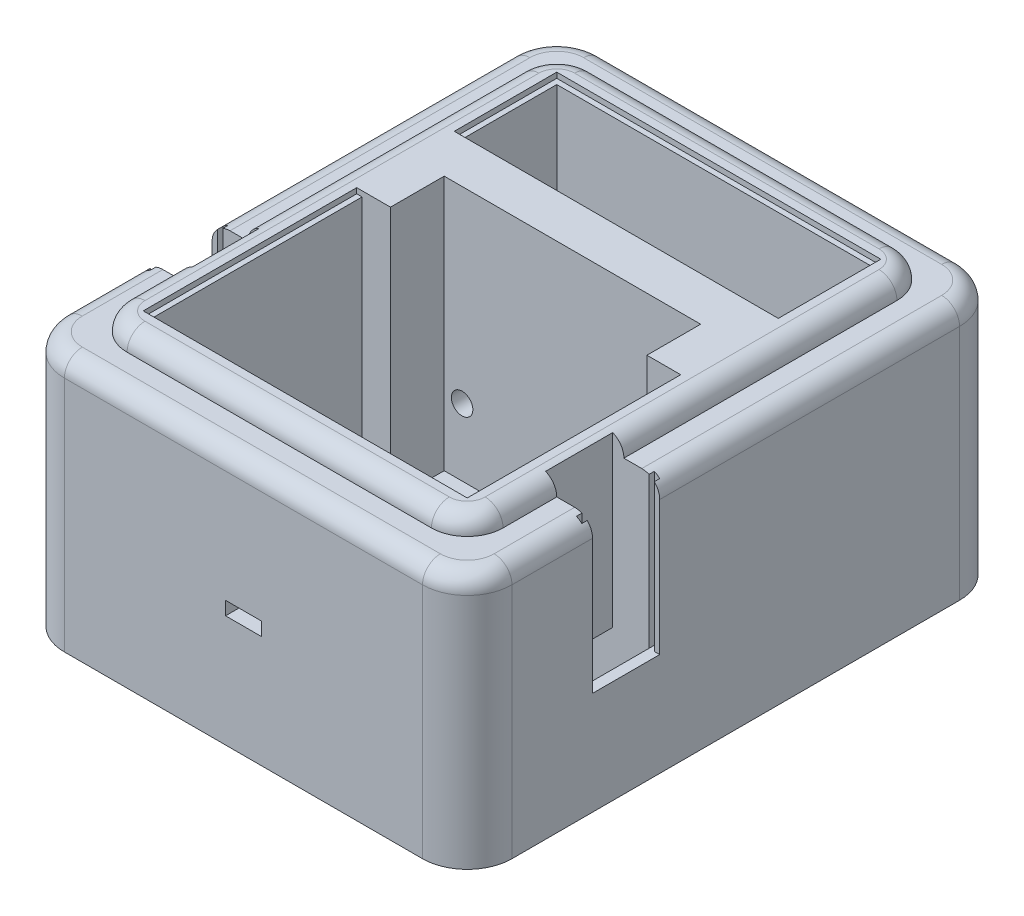
from build123d import *

# Parameters (mm, degrees)
SKICA2_W                  = 100
SKICA2_H                  = 120
P_IDAT_VYSUNUT_M1_DEPTH   = 4
SKICA3_W                  = 15
SKICA3_H                  = 15
SKICA3_W_2                = 70
SKICA3_W_3                = 57.3
SKICA3_H_2                = 3
P_IDAT_VYSUNUT_M2_DEPTH   = 50
SKICA4_W                  = 70
SKICA4_H                  = 20.5
P_IDAT_VYSUNUT_M3_DEPTH   = 23
SKICA8_W                  = 6.35
SKICA8_H                  = 6
ODEBRAT_VYSUNUT_M1_DEPTH  = 23
SKICA9_W                  = 6.35
SKICA9_H                  = 2
P_IDAT_VYSUNUT_M5_DEPTH   = 6
SKICA10_R                 = 2.4
ODEBRAT_VYSUNUT_M2_DEPTH  = 8
SKICA11_W                 = 16.6
SKICA11_H                 = 11.8
ODEBRAT_VYSUNUT_M5_DEPTH  = 10
SKICA14_W                 = 8
SKICA14_H                 = 3
ODEBRAT_VYSUNUT_M6_DEPTH  = 5
SKICA15_W                 = 100
SKICA15_H                 = 120
SKICA15_W_2               = 84
SKICA15_H_2               = 104
ODEBRAT_VYSUNUT_M7_DEPTH  = 4
SKICA20_W                 = 15
SKICA20_H                 = 31
ODEBRAT_VYSUNUT_M8_DEPTH  = 10
SKICA21_W                 = 15
SKICA21_H                 = 31
ODEBRAT_VYSUNUT_M10_DEPTH = 10
SKICA22_R                 = 2.2
ODEBRAT_VYSUNUT_M11_DEPTH = 3
ODEBRAT_START             = -3
SKICA23_R                 = 2.2
ODEBRAT_VYSUNUT_M12_DEPTH = 3
SKICA24_W                 = 1.2
SKICA24_H                 = 1.2
ODEBRAT_VYSUNUT_M14_DEPTH = 27
SKICA26_W                 = 12.6
SKICA26_H                 = 15
ODEBRAT_VYSUNUT_M16_DEPTH = 19
SKICA32_R                 = 2.2
ODEBRAT_VYSUNUT_M19_DEPTH = 158.749801902
SKICA33_W                 = 2
SKICA33_H                 = 6
ODEBRAT_VYSUNUT_M20_DEPTH = 6.35
SKICA35_W                 = 16.6
SKICA35_H                 = 10
ODEBRAT_VYSUNUT_M21_DEPTH = 1.5
SKICA38_W                 = 1
SKICA38_H                 = 23
P_IDAT_VYSUNUT_M9_DEPTH   = 15
SKICA39_W                 = 5.35
SKICA39_H                 = 5
ODEBRAT_VYSUNUT_M23_DEPTH = 23
SKICA40_W                 = 15
SKICA40_H                 = 31
ODEBRAT_VYSUNUT_M24_DEPTH = 0.5
SKICA41_W                 = 15
SKICA41_H                 = 31
ODEBRAT_VYSUNUT_M25_DEPTH = 0.5
SKICA43_W                 = 70
SKICA43_H                 = 20.5
P_IDAT_VYSUNUT_M10_DEPTH  = 7
P_IDAT_VYSUNUT_M11_DEPTH  = 7
SKICA45_W                 = 70
SKICA45_H                 = 1.2
SKICA45_H_2               = 20.5
SKICA45_W_2               = 1.2
SKICA45_H_3               = 46.5
ODEBRAT_VYSUNUT_M26_DEPTH = 1.2
ZAOBLIT1_R                = 10
ZAOBLIT2_R                = 8
ZAOBLIT3_R                = 4


with BuildPart() as part:
    # Skica2 → Přidat vysunutím1 (new body)
    with BuildSketch(Plane(origin=(0, 0, 0), x_dir=(1, 0, 0), z_dir=(0, 1, 0))):
        with Locations((50, 60)):
            Rectangle(SKICA2_W, SKICA2_H)
    extrude(amount=P_IDAT_VYSUNUT_M1_DEPTH)

    # Skica3 → Přidat vysunutím2 (add)
    with BuildSketch(Plane(origin=(0, 4, 0), x_dir=(1, 0, 0), z_dir=(0, 1, 0))):
        with Locations((7.5, 112.5)):
            Rectangle(SKICA3_W, SKICA3_H)
        with Locations((50, 112.5)):
            Rectangle(SKICA3_W_2, SKICA3_H)
        Polygon((15, 105), (0, 105), (0, 15), (15, 15), (15, 61.5), (15, 76.5), (15, 84.5), align=None)
        with Locations((92.5, 112.5)):
            Rectangle(SKICA3_W, SKICA3_H)
        Polygon((100, 105), (85, 105), (85, 84.5), (85, 76.5), (85, 61.5), (85, 15), (100, 15), align=None)
        Polygon((85, 84.5), (15, 84.5), (15, 76.5), (21.35, 76.5), (78.65, 76.5), (85, 76.5), align=None)
        with Locations((7.5, 7.5)):
            Rectangle(SKICA3_W, SKICA3_H)
        with Locations((50, 7.5)):
            Rectangle(SKICA3_W_2, SKICA3_H)
        with Locations((92.5, 7.5)):
            Rectangle(SKICA3_W, SKICA3_H)
        Polygon((21.35, 76.5), (15, 76.5), (15, 61.5), (21.35, 61.5), (21.35, 73.5), align=None)
        with Locations((50, 75)):
            Rectangle(SKICA3_W_3, SKICA3_H_2)
        Polygon((85, 61.5), (85, 76.5), (78.65, 76.5), (78.65, 73.5), (78.65, 61.5), align=None)
    extrude(amount=P_IDAT_VYSUNUT_M2_DEPTH)

    # Skica4 → Přidat vysunutím3 (add)
    with BuildSketch(Plane(origin=(0, 4, 0), x_dir=(1, 0, 0), z_dir=(0, 1, 0))):
        with Locations((50, 94.75)):
            Rectangle(SKICA4_W, SKICA4_H)
    extrude(amount=P_IDAT_VYSUNUT_M3_DEPTH)

    # Skica8 → Odebrat vysunutím1 (cut)
    with BuildSketch(Plane.XY.offset(-61.5)):
        with Locations((81.825, 30)):
            Rectangle(SKICA8_W, SKICA8_H)
    extrude(amount=-ODEBRAT_VYSUNUT_M1_DEPTH, mode=Mode.SUBTRACT)

    # Skica9 → Přidat vysunutím5 (add)
    with BuildSketch(Plane(origin=(0, 27, 0), x_dir=(1, 0, 0), z_dir=(0, 1, 0))):
        with Locations((81.825, 62.5)):
            Rectangle(SKICA9_W, SKICA9_H)
    extrude(amount=P_IDAT_VYSUNUT_M5_DEPTH)

    # Skica10 → Odebrat vysunutím2 (cut)
    with BuildSketch(Plane.XY.offset(-73.5)):
        with Locations((25.35, 19)):
            Circle(SKICA10_R)
        with Locations((74.65, 19)):
            Circle(SKICA10_R)
    extrude(amount=-ODEBRAT_VYSUNUT_M2_DEPTH, mode=Mode.SUBTRACT)

    # Skica11 → Odebrat vysunutím5 (cut)
    with BuildSketch(Plane(origin=(0, 0, -15), x_dir=(-1, 0, 0), z_dir=(0, 0, -1))):
        with Locations((-50, 24.9)):
            Rectangle(SKICA11_W, SKICA11_H)
    extrude(amount=-ODEBRAT_VYSUNUT_M5_DEPTH, mode=Mode.SUBTRACT)

    # Skica14 → Odebrat vysunutím6 (cut)
    with BuildSketch(Plane.XY):
        with Locations((50, 26.5)):
            Rectangle(SKICA14_W, SKICA14_H)
    extrude(amount=-ODEBRAT_VYSUNUT_M6_DEPTH, mode=Mode.SUBTRACT)

    # Skica15 → Odebrat vysunutím7 (cut)
    with BuildSketch(Plane(origin=(0, 54, 0), x_dir=(1, 0, 0), z_dir=(0, 1, 0))):
        with Locations((50, 60)):
            Rectangle(SKICA15_W, SKICA15_H)
        with Locations((50, 60)):
            Rectangle(SKICA15_W_2, SKICA15_H_2, mode=Mode.SUBTRACT)
    extrude(amount=-ODEBRAT_VYSUNUT_M7_DEPTH, mode=Mode.SUBTRACT)

    # Skica20 → Odebrat vysunutím8 (cut)
    with BuildSketch(Plane.ZY):
        with Locations((-35.5, 38.5)):
            Rectangle(SKICA20_W, SKICA20_H)
    extrude(amount=-ODEBRAT_VYSUNUT_M8_DEPTH, mode=Mode.SUBTRACT)

    # Skica21 → Odebrat vysunutím10 (cut)
    with BuildSketch(Plane(origin=(100, 0, 0), x_dir=(0, 0, -1), z_dir=(1, 0, 0))):
        with Locations((35.5, 38.5)):
            Rectangle(SKICA21_W, SKICA21_H)
    extrude(amount=-ODEBRAT_VYSUNUT_M10_DEPTH, mode=Mode.SUBTRACT)

    # Skica22 → Odebrat vysunutím11 (cut)
    with BuildSketch(Plane.ZY.offset(-10)):
        with Locations((-35.5, 31.3)):
            Circle(SKICA22_R)
    extrude(amount=-ODEBRAT_VYSUNUT_M11_DEPTH, mode=Mode.SUBTRACT)

    # Skica23 → Odebrat vysunutím12 (cut)
    with BuildSketch(Plane(origin=(90, 0, 0), x_dir=(0, 0, -1), z_dir=(1, 0, 0)).offset(ODEBRAT_START)):
        with Locations(Location((35.5, 31.3, 0), (0, 0, 180))):
            Circle(SKICA23_R)
    extrude(amount=ODEBRAT_VYSUNUT_M12_DEPTH, mode=Mode.SUBTRACT)

    # Skica24 → Odebrat vysunutím14 (cut)
    with BuildSketch(Plane(origin=(0, 50, 0), x_dir=(1, 0, 0), z_dir=(0, 1, 0))):
        with Locations((1.8, 27.4)):
            Rectangle(SKICA24_W, SKICA24_H)
        with Locations((1.8, 43.6)):
            Rectangle(SKICA24_W, SKICA24_H)
        with Locations((98.2, 27.4)):
            Rectangle(SKICA24_W, SKICA24_H)
        with Locations((98.2, 43.6)):
            Rectangle(SKICA24_W, SKICA24_H)
    extrude(amount=-ODEBRAT_VYSUNUT_M14_DEPTH, mode=Mode.SUBTRACT)

    # Skica26 → Odebrat vysunutím16 (cut)
    with BuildSketch(Plane(origin=(0, 23, 0), x_dir=(1, 0, 0), z_dir=(0, 1, 0))):
        with Locations((8.7, 35.5)):
            Rectangle(SKICA26_W, SKICA26_H)
        with Locations((91.3, 35.5)):
            Rectangle(SKICA26_W, SKICA26_H)
    extrude(amount=-ODEBRAT_VYSUNUT_M16_DEPTH, mode=Mode.SUBTRACT)

    # Skica32 → Odebrat vysunutím19 (cut, through all)
    with BuildSketch(Plane.ZY.offset(-13)):
        with Locations((-35.5, 31.3)):
            Circle(SKICA32_R)
    extrude(amount=-ODEBRAT_VYSUNUT_M19_DEPTH, mode=Mode.SUBTRACT)

    # Skica33 → Odebrat vysunutím20 (cut)
    with BuildSketch(Plane.ZY.offset(-78.65)):
        with Locations((-62.5, 30)):
            Rectangle(SKICA33_W, SKICA33_H)
    extrude(amount=-ODEBRAT_VYSUNUT_M20_DEPTH, mode=Mode.SUBTRACT)

    # Skica35 → Odebrat vysunutím21 (cut)
    with BuildSketch(Plane(origin=(0, 19, 0), x_dir=(1, 0, 0), z_dir=(0, 1, 0))):
        with Locations((50, 10)):
            Rectangle(SKICA35_W, SKICA35_H)
    extrude(amount=-ODEBRAT_VYSUNUT_M21_DEPTH, mode=Mode.SUBTRACT)

    # Skica38 → Přidat vysunutím9 (add)
    with BuildSketch(Plane(origin=(0, 27, 0), x_dir=(1, 0, 0), z_dir=(0, 1, 0))):
        with Locations((79.15, 73)):
            Rectangle(SKICA38_W, SKICA38_H)
    extrude(amount=P_IDAT_VYSUNUT_M9_DEPTH)

    # Skica39 → Odebrat vysunutím23 (cut)
    with BuildSketch(Plane.XY.offset(-61.5)):
        with Locations((82.325, 35.5)):
            Rectangle(SKICA39_W, SKICA39_H)
    extrude(amount=-ODEBRAT_VYSUNUT_M23_DEPTH, mode=Mode.SUBTRACT)

    # Skica40 → Odebrat vysunutím24 (cut)
    with BuildSketch(Plane.ZY.offset(-10)):
        with Locations((-35.5, 38.5)):
            Rectangle(SKICA40_W, SKICA40_H)
    extrude(amount=-ODEBRAT_VYSUNUT_M24_DEPTH, mode=Mode.SUBTRACT)

    # Skica41 → Odebrat vysunutím25 (cut)
    with BuildSketch(Plane(origin=(90, 0, 0), x_dir=(0, 0, -1), z_dir=(1, 0, 0))):
        with Locations((35.5, 38.5)):
            Rectangle(SKICA41_W, SKICA41_H)
    extrude(amount=-ODEBRAT_VYSUNUT_M25_DEPTH, mode=Mode.SUBTRACT)

    # Skica43 → Přidat vysunutím10 (add)
    with BuildSketch(Plane(origin=(0, 54, 0), x_dir=(1, 0, 0), z_dir=(0, 1, 0))):
        Polygon((92, 8), (92, 28), (89.5, 28), (89.5, 43), (92, 43), (92, 112), (8, 112), (8, 43), (10.5, 43), (10.5, 28), (8, 28), (8, 8), align=None)
        with Locations((50, 94.75)):
            Rectangle(SKICA43_W, SKICA43_H, mode=Mode.SUBTRACT)
        Polygon((78.65, 73.5), (78.65, 61.5), (85, 61.5), (85, 15), (15, 15), (15, 61.5), (21.35, 61.5), (21.35, 73.5), align=None, mode=Mode.SUBTRACT)
    extrude(amount=P_IDAT_VYSUNUT_M10_DEPTH)

    # Skica44 → Přidat vysunutím11 (add)
    with BuildSketch(Plane(origin=(0, 50, 0), x_dir=(1, 0, 0), z_dir=(0, 1, 0))):
        Polygon((0, 120), (0, 43), (1.2, 43), (1.2, 44.2), (2.4, 44.2), (2.4, 43), (8, 43), (8, 112), (92, 112), (92, 43), (97.6, 43), (97.6, 44.2), (98.8, 44.2), (98.8, 43), (100, 43), (100, 120), align=None)
        Polygon((1.2, 28), (0, 28), (0, 0), (100, 0), (100, 28), (98.8, 28), (98.8, 26.8), (97.6, 26.8), (97.6, 28), (92, 28), (92, 8), (8, 8), (8, 28), (2.4, 28), (2.4, 26.8), (1.2, 26.8), align=None)
    extrude(amount=P_IDAT_VYSUNUT_M11_DEPTH)

    # Skica45 → Odebrat vysunutím26 (cut)
    with BuildSketch(Plane(origin=(0, 61, 0), x_dir=(1, 0, 0), z_dir=(0, 1, 0))):
        with Locations((50, 105.6)):
            Rectangle(SKICA45_W, SKICA45_H)
        Polygon((15, 84.5), (15, 105), (15, 106.2), (13.8, 106.2), (13.8, 84.5), align=None)
        with Locations((50, 94.75)):
            Rectangle(SKICA45_W, SKICA45_H_2)
        Polygon((85, 106.2), (85, 105), (85, 84.5), (85, 83.3), (86.2, 83.3), (86.2, 106.2), align=None)
        Polygon((85, 84.5), (15, 84.5), (13.8, 84.5), (13.8, 83.3), (85, 83.3), align=None)
        Polygon((85, 15), (15, 15), (13.8, 15), (13.8, 13.8), (85, 13.8), align=None)
        with Locations((14.4, 38.25)):
            Rectangle(SKICA45_W_2, SKICA45_H_3)
        Polygon((85, 61.5), (85, 15), (85, 13.8), (86.2, 13.8), (86.2, 61.5), align=None)
    extrude(amount=-ODEBRAT_VYSUNUT_M26_DEPTH, mode=Mode.SUBTRACT)

    # Zaoblit1
    zaoblit1_edges = [part.edges().sort_by_distance(p)[0] for p in [
        (0, 28.5, -120),
        (100, 28.5, -120),
        (100, 28.5, 0),
        (0, 28.5, 0),
    ]]
    fillet(zaoblit1_edges, radius=ZAOBLIT1_R)

    # Zaoblit2
    zaoblit2_edges = [part.edges().sort_by_distance(p)[0] for p in [
        (92, 59, -8),
        (8, 59, -8),
        (8, 59, -112),
        (92, 59, -112),
    ]]
    fillet(zaoblit2_edges, radius=ZAOBLIT2_R)

    # Zaoblit3
    # the kernel refuses this fillet: 4 mm, written as the material it takes off along each edge
    with BuildSketch(Plane(origin=(8, 61, -104), x_dir=(1, 0, 0), z_dir=(0, 0, 1)), Plane(origin=(92, 61, -33), x_dir=(-1, 0, 0), z_dir=(0, 0, -1))) as zaoblit3_piece_1:
        with BuildLine():
            CenterArc((ZAOBLIT3_R, -ZAOBLIT3_R), ZAOBLIT3_R, 90, 90)
            Line((0, -ZAOBLIT3_R), (0, 0))
            Line((0, 0), (ZAOBLIT3_R, 0))
        make_face()
    extrude(amount=71, mode=Mode.SUBTRACT)
    with BuildSketch(Plane(origin=(100, 57, -10), x_dir=(-1, 0, 0), z_dir=(0, 0, -1)), Plane(origin=(0, 57, -38), x_dir=(1, 0, 0), z_dir=(0, 0, 1))) as zaoblit3_piece_2:
        with BuildLine():
            CenterArc((ZAOBLIT3_R, -ZAOBLIT3_R), ZAOBLIT3_R, 90, 90)
            Line((0, -ZAOBLIT3_R), (0, 0))
            Line((0, 0), (ZAOBLIT3_R, 0))
        make_face()
    extrude(amount=28, mode=Mode.SUBTRACT)
    with BuildSketch(Plane(origin=(100, 57, -33), x_dir=(0, -1, 0), z_dir=(0, 0, -1)), Plane(origin=(0, 57, -110), x_dir=(0, -1, 0), z_dir=(0, 0, 1))) as zaoblit3_piece_3:
        with BuildLine():
            CenterArc((ZAOBLIT3_R, ZAOBLIT3_R), ZAOBLIT3_R, 180, 90)
            Line((0, ZAOBLIT3_R), (0, 0))
            Line((0, 0), (ZAOBLIT3_R, 0))
        make_face()
    extrude(amount=77, mode=Mode.SUBTRACT)
    with BuildSketch(Plane(origin=(10, 57, 0), x_dir=(0, 0, -1), z_dir=(1, 0, 0)), Plane(origin=(90, 57, -120), x_dir=(0, 0, 1), z_dir=(-1, 0, 0))) as zaoblit3_piece_4:
        with BuildLine():
            CenterArc((ZAOBLIT3_R, -ZAOBLIT3_R), ZAOBLIT3_R, 90, 90)
            Line((0, -ZAOBLIT3_R), (0, 0))
            Line((0, 0), (ZAOBLIT3_R, 0))
        make_face()
    extrude(amount=80, mode=Mode.SUBTRACT)
    with BuildSketch(Plane(origin=(10, 57, -10), x_dir=(0, 0, 1), z_dir=(1, 0, 0))) as zaoblit3_piece_5:
        with BuildLine():
            CenterArc((10 - ZAOBLIT3_R, ZAOBLIT3_R), ZAOBLIT3_R, 270, 90)
            Line((10, ZAOBLIT3_R), (10, 0))
            Line((10, 0), (10 - ZAOBLIT3_R, 0))
        make_face()
    revolve(axis=Axis((10, 57, -10), (0, -1, 0)), revolution_arc=90, mode=Mode.SUBTRACT)
    with BuildSketch(Plane(origin=(90, 57, -10), x_dir=(0, 0, 1), z_dir=(-1, 0, 0))) as zaoblit3_piece_6:
        with BuildLine():
            CenterArc((10 - ZAOBLIT3_R, -ZAOBLIT3_R), ZAOBLIT3_R, 0, 90)
            Line((10, -ZAOBLIT3_R), (10, 0))
            Line((10, 0), (10 - ZAOBLIT3_R, 0))
        make_face()
    revolve(axis=Axis((90, 57, -10), (0, 1, 0)), revolution_arc=90, mode=Mode.SUBTRACT)
    with BuildSketch(Plane(origin=(10, 57, -110), x_dir=(0, 0, -1), z_dir=(1, 0, 0))) as zaoblit3_piece_7:
        with BuildLine():
            CenterArc((10 - ZAOBLIT3_R, -ZAOBLIT3_R), ZAOBLIT3_R, 0, 90)
            Line((10, -ZAOBLIT3_R), (10, 0))
            Line((10, 0), (10 - ZAOBLIT3_R, 0))
        make_face()
    revolve(axis=Axis((10, 57, -110), (0, 1, 0)), revolution_arc=90, mode=Mode.SUBTRACT)
    with BuildSketch(Plane(origin=(90, 57, -110), x_dir=(0, 0, -1), z_dir=(-1, 0, 0))) as zaoblit3_piece_8:
        with BuildLine():
            CenterArc((10 - ZAOBLIT3_R, ZAOBLIT3_R), ZAOBLIT3_R, 270, 90)
            Line((10, ZAOBLIT3_R), (10, 0))
            Line((10, 0), (10 - ZAOBLIT3_R, 0))
        make_face()
    revolve(axis=Axis((90, 57, -110), (0, -1, 0)), revolution_arc=90, mode=Mode.SUBTRACT)
    with BuildSketch(Plane(origin=(16, 61, -8), x_dir=(0, -1, 0), z_dir=(1, 0, 0))) as zaoblit3_piece_9:
        with BuildLine():
            CenterArc((ZAOBLIT3_R, ZAOBLIT3_R), ZAOBLIT3_R, 180, 90)
            Line((0, ZAOBLIT3_R), (0, 0))
            Line((0, 0), (ZAOBLIT3_R, 0))
        make_face()
    extrude(amount=68, mode=Mode.SUBTRACT)
    with BuildSketch(Plane(origin=(84, 61, -112), x_dir=(0, 0, 1), z_dir=(-1, 0, 0))) as zaoblit3_piece_10:
        with BuildLine():
            CenterArc((ZAOBLIT3_R, -ZAOBLIT3_R), ZAOBLIT3_R, 90, 90)
            Line((0, -ZAOBLIT3_R), (0, 0))
            Line((0, 0), (ZAOBLIT3_R, 0))
        make_face()
    extrude(amount=68, mode=Mode.SUBTRACT)
    with BuildSketch(Plane(origin=(84, 61, -16), x_dir=(0, 0, 1), z_dir=(-1, 0, 0))) as zaoblit3_piece_11:
        with BuildLine():
            CenterArc((8 - ZAOBLIT3_R, -ZAOBLIT3_R), ZAOBLIT3_R, 0, 90)
            Line((8 - ZAOBLIT3_R, 0), (8, 0))
            Line((8, 0), (8, -ZAOBLIT3_R))
        make_face()
    revolve(axis=Axis((84, 61, -16), (0, 1, 0)), revolution_arc=90, mode=Mode.SUBTRACT)
    with BuildSketch(Plane(origin=(84, 61, -104), x_dir=(0, 0, -1), z_dir=(-1, 0, 0))) as zaoblit3_piece_12:
        with BuildLine():
            CenterArc((8 - ZAOBLIT3_R, ZAOBLIT3_R), ZAOBLIT3_R, 270, 90)
            Line((8, ZAOBLIT3_R), (8, 0))
            Line((8, 0), (8 - ZAOBLIT3_R, 0))
        make_face()
    revolve(axis=Axis((84, 61, -104), (0, -1, 0)), revolution_arc=90, mode=Mode.SUBTRACT)
    with BuildSketch(Plane(origin=(16, 61, -104), x_dir=(-1, 0, 0), z_dir=(0, 0, 1))) as zaoblit3_piece_13:
        with BuildLine():
            CenterArc((8 - ZAOBLIT3_R, ZAOBLIT3_R), ZAOBLIT3_R, 270, 90)
            Line((8, ZAOBLIT3_R), (8, 0))
            Line((8, 0), (8 - ZAOBLIT3_R, 0))
        make_face()
    revolve(axis=Axis((16, 61, -104), (0, -1, 0)), revolution_arc=90, mode=Mode.SUBTRACT)
    with BuildSketch(Plane(origin=(16, 61, -16), x_dir=(-1, 0, 0), z_dir=(0, 0, -1))) as zaoblit3_piece_14:
        with BuildLine():
            CenterArc((8 - ZAOBLIT3_R, -ZAOBLIT3_R), ZAOBLIT3_R, 0, 90)
            Line((8 - ZAOBLIT3_R, 0), (8, 0))
            Line((8, 0), (8, -ZAOBLIT3_R))
        make_face()
    revolve(axis=Axis((16, 61, -16), (0, 1, 0)), revolution_arc=90, mode=Mode.SUBTRACT)
    with BuildSketch(Plane(origin=(8, 61, -38), x_dir=(0, -1, 0), z_dir=(0, 0, 1)), Plane(origin=(92, 61, -16), x_dir=(0, -1, 0), z_dir=(0, 0, -1))) as zaoblit3_piece_15:
        with BuildLine():
            CenterArc((ZAOBLIT3_R, ZAOBLIT3_R), ZAOBLIT3_R, 180, 90)
            Line((0, ZAOBLIT3_R), (0, 0))
            Line((0, 0), (ZAOBLIT3_R, 0))
        make_face()
    extrude(amount=22, mode=Mode.SUBTRACT)


solid = part.part
